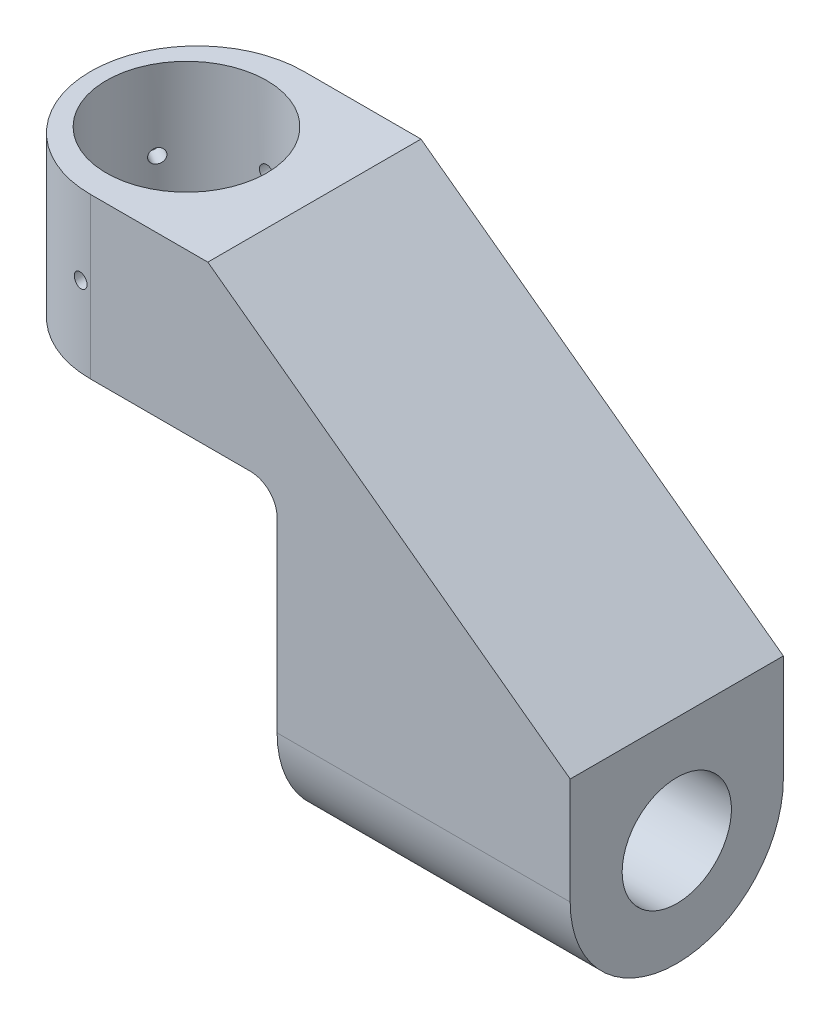
from build123d import *

# Parameters (mm, degrees)
BOSS_EXTRUDE1_DEPTH     = 40
FILLET1_R               = 5
CUT_EXTRUDE1_REACH      = 114.805
SKETCH2_R               = 10.25
CUT_EXTRUDE2_REACH      = 133.529
SKETCH3_R               = 15.05
FILLET3_R               = 20
CUT_EXTRUDE5_DEPTH      = 37
CUT_EXTRUDE5_DEPTH_BACK = 7
SKETCH7_R               = 1.325
CUT_EXTRUDE7_DEPTH      = 7
CUT_EXTRUDE7_DEPTH_BACK = 7
SKETCH8_R               = 1.325
CUT_EXTRUDE8_DEPTH      = 7
CUT_EXTRUDE8_DEPTH_BACK = 7
SKETCH9_R               = 1.325
FILLET4_START           = -30
FILLET4_DEPTH           = 30


with BuildPart() as part:
    # Sketch1 → Boss-Extrude1 (new body)
    with BuildSketch(Plane.XY):
        Polygon((0, 0), (42, 0), (110, -50), (110, -90), (55, -90), (55, -30), (0, -30), align=None)
    extrude(amount=BOSS_EXTRUDE1_DEPTH)

    # Fillet1
    fillet1_edges = [part.edges().sort_by_distance(p)[0] for p in [
        (55, -30, 20),
    ]]
    fillet(fillet1_edges, radius=FILLET1_R)

    # Sketch2 → Cut-Extrude1 (cut, up to next)
    with BuildSketch(Plane.ZY.offset(-55), mode=Mode.PRIVATE) as cut_extrude1_sk1:
        with Locations((20, -70)):
            Circle(SKETCH2_R)
    cut_extrude1_tool1 = extrude(cut_extrude1_sk1.sketch, amount=-CUT_EXTRUDE1_REACH, mode=Mode.PRIVATE) & part.part
    add(cut_extrude1_tool1.solids().sort_by_distance((55, -70, 20))[0], mode=Mode.SUBTRACT)

    # Sketch3 → Cut-Extrude2 (cut, up to next)
    with BuildSketch(Plane.XZ.offset(30), mode=Mode.PRIVATE) as cut_extrude2_sk1:
        with Locations((18, 20)):
            Circle(SKETCH3_R)
    cut_extrude2_tool1 = extrude(cut_extrude2_sk1.sketch, amount=-CUT_EXTRUDE2_REACH, mode=Mode.PRIVATE) & part.part
    add(cut_extrude2_tool1.solids().sort_by_distance((18, -30, 20))[0], mode=Mode.SUBTRACT)

    # Fillet3
    fillet3_edges = [part.edges().sort_by_distance(p)[0] for p in [
        (82.5, -90, 0),
        (82.5, -90, 40),
    ]]
    fillet(fillet3_edges, radius=FILLET3_R - 0.0001)  # a hair under: the kernel refuses the full size

    # Sketch7 → Cut-Extrude5 (cut, two sides: drawn at the far end of the back side and taken through both)
    with BuildSketch(Plane.XY.offset(4.95).offset(-CUT_EXTRUDE5_DEPTH_BACK)):
        with Locations(Location((18, -15, 0), (0, 0, 180))):
            Circle(SKETCH7_R)
    extrude(amount=CUT_EXTRUDE5_DEPTH + CUT_EXTRUDE5_DEPTH_BACK, mode=Mode.SUBTRACT)

    # Sketch8 → Cut-Extrude7 (cut, two sides: drawn at the far end of the back side and taken through both)
    with BuildSketch(Plane(origin=(9.126571711, 0, 5.269228634), x_dir=(0.4999999999999973, 0, -0.8660254037844402), z_dir=(0.8660254037844403, 0, 0.4999999999999973)).offset(-CUT_EXTRUDE7_DEPTH_BACK)):
        with Locations(Location((-8.320508076, -15, 0), (0, 0, 180))):
            Circle(SKETCH8_R)
    extrude(amount=CUT_EXTRUDE7_DEPTH + CUT_EXTRUDE7_DEPTH_BACK, mode=Mode.SUBTRACT)

    # Sketch9 → Cut-Extrude8 (cut, two sides: drawn at the far end of the back side and taken through both)
    with BuildSketch(Plane(origin=(4.966317673, 0, 27.525), x_dir=(-0.49999999999999806, 0, -0.8660254037844399), z_dir=(0.8660254037844399, 0, -0.49999999999999806)).offset(-CUT_EXTRUDE8_DEPTH_BACK)):
        with Locations(Location((0, -15, 0), (0, 0, 180))):
            Circle(SKETCH9_R)
    extrude(amount=CUT_EXTRUDE8_DEPTH + CUT_EXTRUDE8_DEPTH_BACK, mode=Mode.SUBTRACT)

    # Fillet4: read off the stored shape, not the designer's step
    # Fillet4 outline → Fillet4 (cut)
    with BuildSketch(Plane(origin=(0, 0, 0), x_dir=(1, 0, 0), z_dir=(0, 1, 0)).offset(FILLET4_START)):
        with BuildLine():
            ThreePointArc((20, -40), (5.857864376, -34.142135624), (0, -20))
            Line((0, -20), (0, -40))
            Line((0, -40), (20, -40))
        make_face()
        with BuildLine():
            ThreePointArc((0, -20), (5.857864376, -5.857864376), (20, 0))
            Line((20, 0), (0, 0))
            Line((0, 0), (0, -20))
        make_face()
    extrude(amount=FILLET4_DEPTH, mode=Mode.SUBTRACT)


solid = part.part
